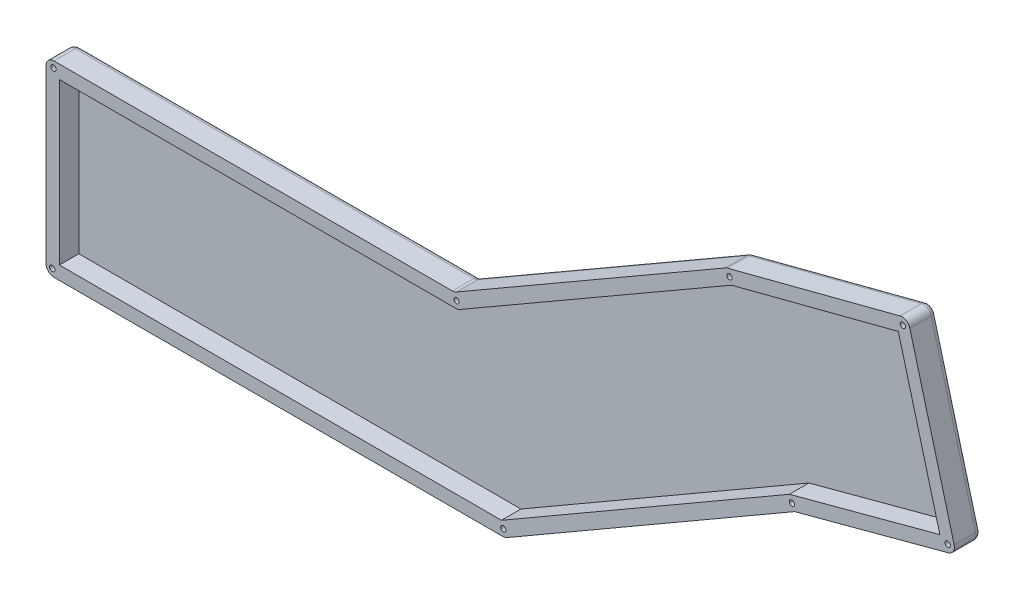
from build123d import *

# Parameters (mm, degrees)
BOSS_EXTRU_1_DEPTH      = 10
CONG_1_R                = 3
BOSS_EXTRU_2_DEPTH      = 2.7
CONG_2_R                = 2
ESQUISSE3_R             = 1
ENL_V_MAT_EXTRU_1_DEPTH = 20
ESQUISSE4_R             = 2
ENL_V_MAT_EXTRU_2_DEPTH = 2


with BuildPart() as part:
    # Model → Boss.-Extru.1 (new body)
    with BuildSketch(Plane.XY):
        Polygon((75.33141454, 71.077500491), (-26.464533767, 12.30154537), (-179.373873722, 12.291034855), (-179.373873722, -50.687645053), (-179.373873722, -57.858487698), (-7.520422715, -57.858487698), (100.854480283, 4.809102496), (161.383942986, 21.020985262), (143.246352653, 88.745859712), align=None)
        Polygon((-174.373873722, 7.291378528), (-25.124548608, 7.301637465), (77.245358051, 66.408990356), (139.700811798, 82.657041562), (155.26069475, 24.557200291), (98.923133978, 9.468053786), (-8.861972593, -52.858487698), (-174.373873722, -52.858487698), (-174.373873722, -50.687645053), align=None, mode=Mode.SUBTRACT)
    extrude(amount=BOSS_EXTRU_1_DEPTH)

    # Congé1
    cong_1_edges = [part.edges().sort_by_distance(p)[0] for p in [
        (-26.464533767, 12.30154537, 5),
        (75.33141454, 71.077500491, 5),
        (143.246352653, 88.745859712, 5),
        (161.383942986, 21.020985262, 5),
        (100.854480283, 4.809102496, 5),
        (-7.520422715, -57.858487698, 5),
        (-179.373873722, -57.858487698, 5),
        (-179.373873722, 12.291034855, 5),
    ]]
    fillet(cong_1_edges, radius=CONG_1_R)

    # Esquisse1 → Boss.-Extru.2 (add)
    with BuildSketch(Plane.XY):
        Polygon((-25.124548608, 7.301637465), (-174.373873722, 7.291378528), (-174.373873722, -50.687645053), (-174.373873722, -52.858487698), (-8.861972593, -52.858487698), (98.923133978, 9.468053786), (155.26069475, 24.557200291), (139.700811798, 82.657041562), (77.245358051, 66.408990356), align=None)
    extrude(amount=BOSS_EXTRU_2_DEPTH)

    # Congé2
    cong_2_edges = [part.edges().sort_by_distance(p)[0] for p in [
        (100.86445313, 4.78504518, 0),
        (46.843967712, -26.422377988, 0),
        (-7.547920203, -57.756003669, 0),
        (-92.349613182, -57.858487698, 0),
        (-178.495194066, -56.979808041, 0),
        (-179.373873722, -22.78362332, 0),
        (-178.495266971, 11.412488494, 0),
        (-101.821199292, 12.296365586, 0),
        (-26.491925042, 12.40375087, 0),
        (24.605627892, 41.788942262, 0),
        (75.341794938, 71.05218052, 0),
        (108.044083383, 79.587840046, 0),
        (142.628648998, 87.685066626, 0),
        (152.312387337, 54.893729991, 0),
        (160.307894606, 21.642410085, 0),
        (129.861641055, 12.578223, 0),
    ]]
    fillet(cong_2_edges, radius=CONG_2_R)

    # Esquisse3 → Enlèv. mat.-Extru.1 (cut)
    with BuildSketch(Plane.XY):
        with Locations((158.201617013, 22.958080812)):
            Circle(ESQUISSE3_R)
        with Locations((141.388472611, 85.534334234)):
            Circle(ESQUISSE3_R)
        with Locations((76.500226548, 68.776582274)):
            Circle(ESQUISSE3_R)
        with Locations((99.890442316, 7.071415488)):
            Circle(ESQUISSE3_R)
        with Locations((-8.172352823, -55.275906246)):
            Circle(ESQUISSE3_R)
        with Locations((-25.691359515, 9.920090126)):
            Circle(ESQUISSE3_R)
        with Locations((-176.562127678, 9.920090126)):
            Circle(ESQUISSE3_R)
        with Locations((-177.029598341, -55.275906246)):
            Circle(ESQUISSE3_R)
    extrude(amount=ENL_V_MAT_EXTRU_1_DEPTH, mode=Mode.SUBTRACT)

    # Esquisse4 → Enlèv. mat.-Extru.2 (cut)
    with BuildSketch(Plane(origin=(0, 0, 0), x_dir=(-1, 0, 0), z_dir=(0, 0, -1))):
        with Locations((177.029598341, -55.275906246)):
            Circle(ESQUISSE4_R)
        with Locations((176.562127678, 9.920090126)):
            Circle(ESQUISSE4_R)
        with Locations((25.691359515, 9.920090126)):
            Circle(ESQUISSE4_R)
        with Locations((-76.500226548, 68.776582274)):
            Circle(ESQUISSE4_R)
        with Locations((-141.388472611, 85.534334234)):
            Circle(ESQUISSE4_R)
        with Locations((-158.201617013, 22.958080812)):
            Circle(ESQUISSE4_R)
        with Locations((-99.890442316, 7.071415488)):
            Circle(ESQUISSE4_R)
        with Locations((8.172352823, -55.275906246)):
            Circle(ESQUISSE4_R)
    extrude(amount=-ENL_V_MAT_EXTRU_2_DEPTH, mode=Mode.SUBTRACT)


solid = part.part
